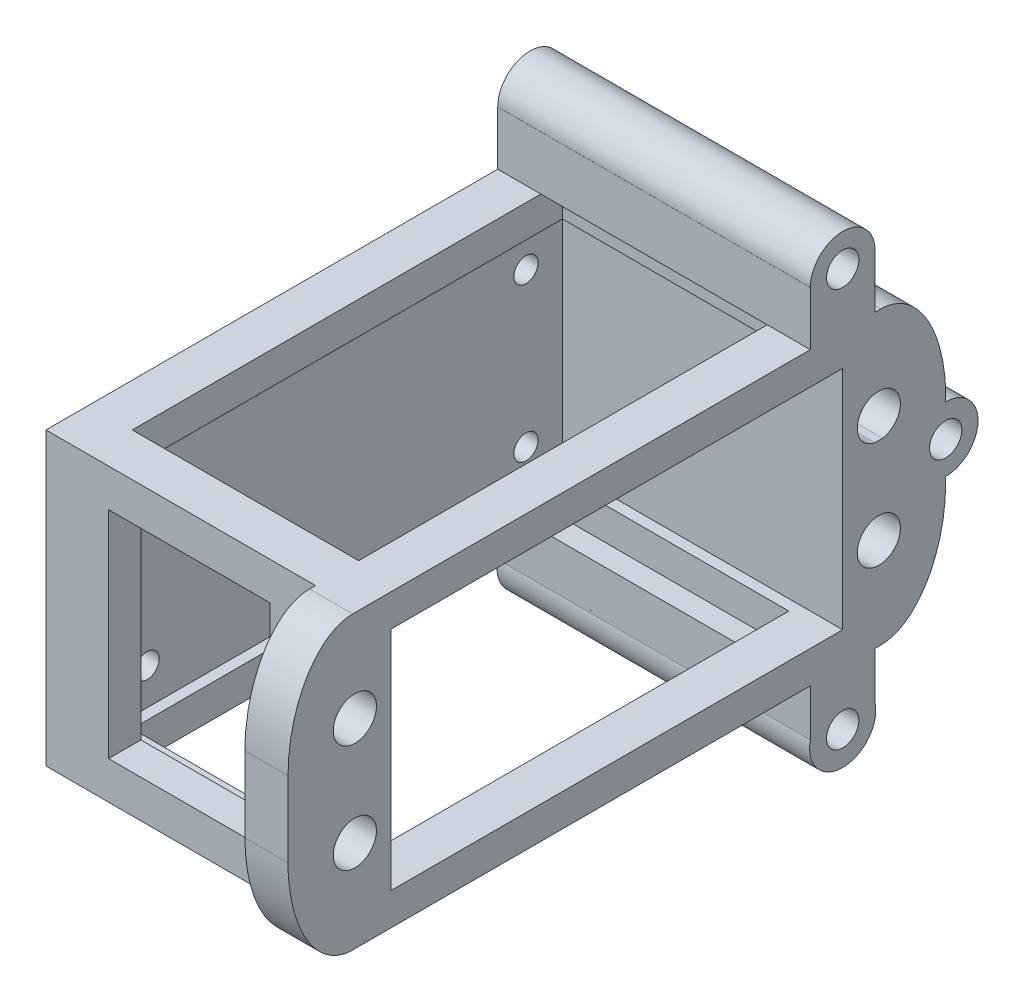
from build123d import *

# Parameters (mm, degrees)
SKETCH1_W            = 41.9
SKETCH1_H            = 21
SKETCH1_R            = 1.125
BOSS_EXTRUDE1_DEPTH  = 3
SKETCH1_3_W          = 47.9
SKETCH1_3_H          = 27
SKETCH1_3_W_2        = 41.9
SKETCH1_3_H_2        = 21
BOSS_EXTRUDE2_DEPTH  = 29
CUT_EXTRUDE1_REACH   = 62.921
SKETCH2_W            = 15
SKETCH2_H            = 20
SKETCH4_W            = 21
SKETCH4_H            = 39.9
CUT_EXTRUDE2_DEPTH   = 35
SKETCH5_R            = 4
BOSS_EXTRUDE3_DEPTH  = 4
SKETCH6_W            = 4
SKETCH6_H            = 27
BOSS_EXTRUDE4_DEPTH  = 6.55
SKETCH7_W            = 4
SKETCH7_H            = 27
BOSS_EXTRUDE5_DEPTH  = 6.55
CUT_EXTRUDE3_REACH   = 67.667
SKETCH10_R           = 2
BOSS_EXTRUDE10_REACH = 65.75
SKETCH11_R           = 1.5
FILLET3_SIZE         = 10
FILLET3_SIZE_2       = 6
CUT_EXTRUDE4_REACH   = 73.257
SKETCH12_R           = 1.5


with BuildPart() as part:
    # Sketch1 → Boss-Extrude1 (new body)
    with BuildSketch(Plane(origin=(0, 0, 0), x_dir=(0, 0, -1), z_dir=(1, 0, 0))):
        with Locations((20.95, 10.5)):
            Rectangle(SKETCH1_W, SKETCH1_H)
        with Locations((38.52, 17.62)):
            Circle(SKETCH1_R, mode=Mode.SUBTRACT)
        with Locations((38.52, 3.38)):
            Circle(SKETCH1_R, mode=Mode.SUBTRACT)
        with Locations((3.38, 17.62)):
            Circle(SKETCH1_R, mode=Mode.SUBTRACT)
        with Locations((3.38, 3.38)):
            Circle(SKETCH1_R, mode=Mode.SUBTRACT)
    extrude(amount=BOSS_EXTRUDE1_DEPTH)

    # Sketch1<3> → Boss-Extrude2 (add)
    with BuildSketch(Plane(origin=(0, 0, 0), x_dir=(0, 0, -1), z_dir=(1, 0, 0))):
        with Locations((20.95, 10.5)):
            Rectangle(SKETCH1_3_W, SKETCH1_3_H)
        with Locations((20.95, 10.5)):
            Rectangle(SKETCH1_3_W_2, SKETCH1_3_H_2, mode=Mode.SUBTRACT)
    extrude(amount=BOSS_EXTRUDE2_DEPTH)

    # Sketch2 → Cut-Extrude1 (cut, up to next)
    with BuildSketch(Plane.XY.offset(3), mode=Mode.PRIVATE) as cut_extrude1_sk1:
        with Locations((13.3, 10.5)):
            Rectangle(SKETCH2_W, SKETCH2_H)
    cut_extrude1_tool1 = extrude(cut_extrude1_sk1.sketch, amount=-CUT_EXTRUDE1_REACH, mode=Mode.PRIVATE) & part.part
    add(cut_extrude1_tool1.solids().sort_by_distance((13.3, 10.5, 3))[0], mode=Mode.SUBTRACT)

    # Sketch4 → Cut-Extrude2 (cut)
    with BuildSketch(Plane.XZ.offset(3)):
        with Locations((14.5, -20.95)):
            Rectangle(SKETCH4_W, SKETCH4_H)
    extrude(amount=-CUT_EXTRUDE2_DEPTH, mode=Mode.SUBTRACT)

    # Sketch5 → Boss-Extrude3 (add)
    with BuildSketch(Plane.ZY):
        with Locations(Location((-10.5, 10.5, 0), (0, 0, 180))):
            Circle(SKETCH5_R)
    extrude(amount=BOSS_EXTRUDE3_DEPTH)

    # Sketch6 → Boss-Extrude4 (add)
    with BuildSketch(Plane(origin=(0, 0, -44.9), x_dir=(-1, 0, 0), z_dir=(0, 0, -1))):
        with Locations((-27, 10.5)):
            Rectangle(SKETCH6_W, SKETCH6_H)
    extrude(amount=BOSS_EXTRUDE4_DEPTH)

    # Sketch7 → Boss-Extrude5 (add)
    with BuildSketch(Plane.XY.offset(3)):
        with Locations((27, 10.5)):
            Rectangle(SKETCH7_W, SKETCH7_H)
    extrude(amount=BOSS_EXTRUDE5_DEPTH)

    # Sketch10 → Cut-Extrude3 (cut, up to next)
    with BuildSketch(Plane(origin=(29, 0, 0), x_dir=(0, 0, -1), z_dir=(1, 0, 0)), mode=Mode.PRIVATE) as cut_extrude3_sk1:
        with Locations((-3.35, 15.5)):
            Circle(SKETCH10_R)
    cut_extrude3_tool1 = extrude(cut_extrude3_sk1.sketch, amount=-CUT_EXTRUDE3_REACH, mode=Mode.PRIVATE) & part.part
    # Sketch10 → Cut-Extrude3 (cut, up to next)
    with BuildSketch(Plane(origin=(29, 0, 0), x_dir=(0, 0, -1), z_dir=(1, 0, 0)), mode=Mode.PRIVATE) as cut_extrude3_sk2:
        with Locations((-3.35, 5.5)):
            Circle(SKETCH10_R)
    cut_extrude3_tool2 = extrude(cut_extrude3_sk2.sketch, amount=-CUT_EXTRUDE3_REACH, mode=Mode.PRIVATE) & part.part
    # Sketch10 → Cut-Extrude3 (cut, up to next)
    with BuildSketch(Plane(origin=(29, 0, 0), x_dir=(0, 0, -1), z_dir=(1, 0, 0)), mode=Mode.PRIVATE) as cut_extrude3_sk3:
        with Locations((45.25, 5.5)):
            Circle(SKETCH10_R)
    cut_extrude3_tool3 = extrude(cut_extrude3_sk3.sketch, amount=-CUT_EXTRUDE3_REACH, mode=Mode.PRIVATE) & part.part
    # Sketch10 → Cut-Extrude3 (cut, up to next)
    with BuildSketch(Plane(origin=(29, 0, 0), x_dir=(0, 0, -1), z_dir=(1, 0, 0)), mode=Mode.PRIVATE) as cut_extrude3_sk4:
        with Locations((45.25, 15.5)):
            Circle(SKETCH10_R)
    cut_extrude3_tool4 = extrude(cut_extrude3_sk4.sketch, amount=-CUT_EXTRUDE3_REACH, mode=Mode.PRIVATE) & part.part
    add(cut_extrude3_tool1.solids().sort_by_distance((29, 15.5, 3.35))[0], mode=Mode.SUBTRACT)
    add(cut_extrude3_tool2.solids().sort_by_distance((29, 5.5, 3.35))[0], mode=Mode.SUBTRACT)
    add(cut_extrude3_tool3.solids().sort_by_distance((29, 5.5, -45.25))[0], mode=Mode.SUBTRACT)
    add(cut_extrude3_tool4.solids().sort_by_distance((29, 15.5, -45.25))[0], mode=Mode.SUBTRACT)

    # Boss-Extrude10: up to this face of the body (flat: up to its plane)
    boss_extrude10_end = Plane(part.part.faces().sort_by_distance((29, 10.5, -50.782916797))[0])
    # Sketch11 → Boss-Extrude10 (add, up to the picked face)
    with BuildSketch(Plane.ZY, mode=Mode.PRIVATE) as boss_extrude10_sk1:
        with BuildLine():
            Line((-44.9, 29), (-44.9, 24))
            Line((-44.9, 24), (-38.9, 24))
            Line((-38.9, 24), (-38.9, 29))
            Line((-38.9, 29), (-38.903642649, 29))
            ThreePointArc((-38.903642649, 29), (-41.9, 31.996357351), (-44.896357351, 29))
            Line((-44.896357351, 29), (-44.9, 29))
        make_face()
        with Locations((-41.9, 29)):
            Circle(SKETCH11_R, mode=Mode.SUBTRACT)
    boss_extrude10_tool1 = split(extrude(boss_extrude10_sk1.sketch, amount=-BOSS_EXTRUDE10_REACH, mode=Mode.PRIVATE), bisect_by=boss_extrude10_end, keep=Keep.BOTH, mode=Mode.PRIVATE)
    # Sketch11 → Boss-Extrude10 (add, up to the picked face)
    with BuildSketch(Plane.ZY, mode=Mode.PRIVATE) as boss_extrude10_sk2:
        with BuildLine():
            Line((-44.9, 7.530863133), (-44.9, 13.530863133))
            Line((-44.9, 13.530863133), (-51.45, 13.530863133))
            ThreePointArc((-51.45, 13.530863133), (-54.45, 10.530863133), (-51.45, 7.530863133))
            Line((-51.45, 7.530863133), (-44.9, 7.530863133))
        make_face()
        with Locations((-51.45, 10.530863133)):
            Circle(SKETCH11_R, mode=Mode.SUBTRACT)
    boss_extrude10_tool2 = split(extrude(boss_extrude10_sk2.sketch, amount=-BOSS_EXTRUDE10_REACH, mode=Mode.PRIVATE), bisect_by=boss_extrude10_end, keep=Keep.BOTH, mode=Mode.PRIVATE)
    # Sketch11 → Boss-Extrude10 (add, up to the picked face)
    with BuildSketch(Plane.ZY, mode=Mode.PRIVATE) as boss_extrude10_sk3:
        with BuildLine():
            Line((-38.9, -3), (-44.9, -3))
            Line((-44.9, -3), (-44.9, -7.358406619))
            ThreePointArc((-44.9, -7.358406619), (-41.9, -11.067839968), (-38.9, -7.358406619))
            Line((-38.9, -7.358406619), (-38.9, -3))
        make_face()
        with Locations((-41.9, -8)):
            Circle(SKETCH11_R, mode=Mode.SUBTRACT)
    boss_extrude10_tool3 = split(extrude(boss_extrude10_sk3.sketch, amount=-BOSS_EXTRUDE10_REACH, mode=Mode.PRIVATE), bisect_by=boss_extrude10_end, keep=Keep.BOTH, mode=Mode.PRIVATE)
    add(boss_extrude10_tool1.solids().sort_by(Axis((0, 27.459117, -41.9), (1, 0, 0)))[0])
    add(boss_extrude10_tool2.solids().sort_by(Axis((0, 10.530863, -49.062446), (1, 0, 0)))[0])
    add(boss_extrude10_tool3.solids().sort_by(Axis((0, -5.179203, -39.001359), (1, 0, 0)))[0])

    # Fillet3
    # an asymmetric fillet: 10, 6 mm, written as the material it takes off along each edge
    with BuildSketch(Plane(origin=(54, 24, 9.55), x_dir=(0, -1, 0), z_dir=(-1, 0, 0)), Plane(origin=(0, 24, -51.45), x_dir=(0, -1, 0), z_dir=(1, 0, 0))) as fillet3_piece_1:
        with BuildLine():
            Bezier((FILLET3_SIZE, 0), (0, 0), (0, -FILLET3_SIZE_2), weights=[1, 0.707106781, 1])
            Line((0, -FILLET3_SIZE_2), (0, 0))
            Line((0, 0), (FILLET3_SIZE, 0))
        make_face()
    extrude(amount=54, mode=Mode.SUBTRACT)
    with BuildSketch(Plane(origin=(0, -3, 9.55), x_dir=(0, 0, -1), z_dir=(1, 0, 0)), Plane(origin=(54, -3, -51.45), x_dir=(0, 0, 1), z_dir=(-1, 0, 0))) as fillet3_piece_2:
        with BuildLine():
            Bezier((FILLET3_SIZE_2, 0), (0, 0), (0, FILLET3_SIZE), weights=[1, 0.707106781, 1])
            Line((0, FILLET3_SIZE), (0, 0))
            Line((0, 0), (FILLET3_SIZE_2, 0))
        make_face()
    extrude(amount=54, mode=Mode.SUBTRACT)

    # Sketch12 → Cut-Extrude4 (cut, up to next)
    with BuildSketch(Plane(origin=(29, 0, 0), x_dir=(0, 0, -1), z_dir=(1, 0, 0)), mode=Mode.PRIVATE) as cut_extrude4_sk1:
        with Locations(Location((51.45, 10.530863133, 0), (0, 0, 180))):
            Circle(SKETCH12_R)
    cut_extrude4_tool1 = extrude(cut_extrude4_sk1.sketch, amount=-CUT_EXTRUDE4_REACH, mode=Mode.PRIVATE) & part.part
    add(cut_extrude4_tool1.solids().sort_by_distance((29, 10.530863, -51.45))[0], mode=Mode.SUBTRACT)


solid = part.part
